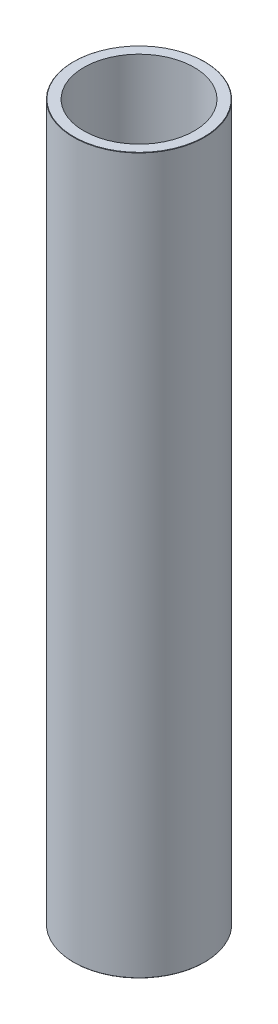
from build123d import *
from OCP.BRepFilletAPI import BRepFilletAPI_MakeChamfer

# Parameters (mm, degrees)
SKETCH1_R           = 55
BOSS_EXTRUDE1_DEPTH = 600
SKETCH2_R           = 46.275408685
CUT_EXTRUDE1_DEPTH  = 606.020660804
CHAMFER1_SIZE       = 0.233671092
CHAMFER1_SIZE2      = 0.307946687


with BuildPart() as part:
    # Sketch1 → Boss-Extrude1 (new body)
    with BuildSketch(Plane(origin=(0, 0, 0), x_dir=(1, 0, 0), z_dir=(0, 1, 0))):
        Circle(SKETCH1_R)
    extrude(amount=BOSS_EXTRUDE1_DEPTH)

    # Sketch2 → Cut-Extrude1 (cut, through all)
    with BuildSketch(Plane(origin=(0, 0, 0), x_dir=(1, 0, 0), z_dir=(0, 1, 0))):
        Circle(SKETCH2_R)
    extrude(amount=CUT_EXTRUDE1_DEPTH, mode=Mode.SUBTRACT)

    # Chamfer1: one chamfer whose edges measure the first distance from different faces: ONE call of the kernel's chamfer builder (chamfer() names one face for all edges)
    chamfer1_edges_1 = [part.edges().sort_by_distance(p)[0] for p in [
        (-55, 600, 0),
    ]]
    chamfer1_side_1 = [part.faces().sort_by_distance(p)[0] for p in [
        (-55, 300, 0),
    ]]
    chamfer1_edges_2 = [part.edges().sort_by_distance(p)[0] for p in [
        (-55, 0, 0),
    ]]
    chamfer1_side_2 = [part.faces().sort_by_distance(p)[0] for p in [
        (-53.444365081, 0, 0),
    ]]
    chamfer1 = BRepFilletAPI_MakeChamfer(part.part.solid().wrapped)
    for e in chamfer1_edges_1:
        chamfer1.Add(CHAMFER1_SIZE, CHAMFER1_SIZE2, e.wrapped, chamfer1_side_1[0].wrapped)  # the first distance lies on this face
    for e in chamfer1_edges_2:
        chamfer1.Add(CHAMFER1_SIZE, CHAMFER1_SIZE2, e.wrapped, chamfer1_side_2[0].wrapped)  # the first distance lies on this face
    add(Compound.cast(chamfer1.Shape()), mode=Mode.REPLACE)


solid = part.part
